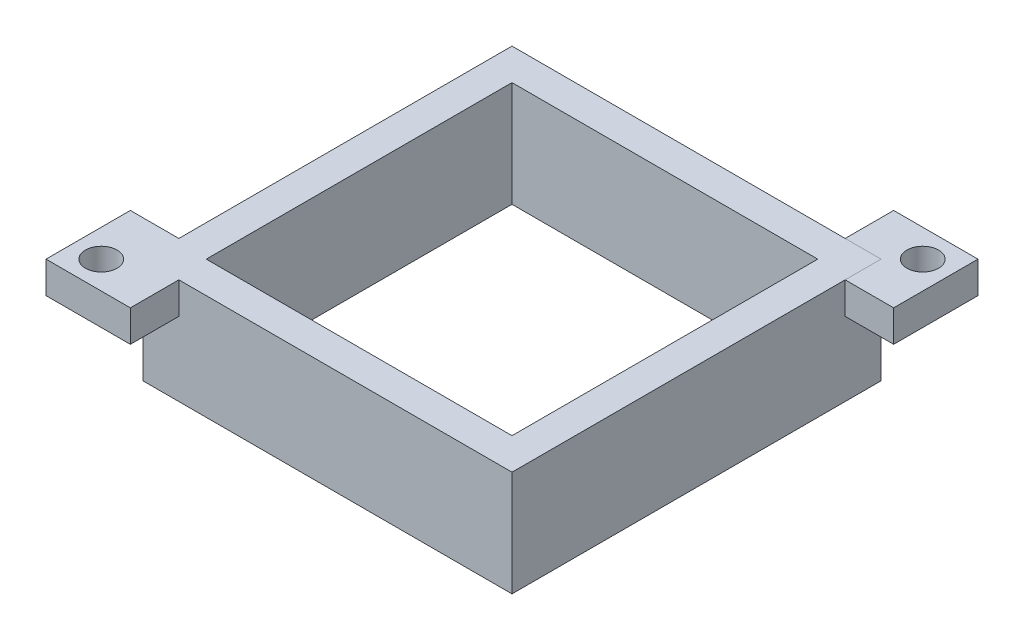
from build123d import *

# Parameters (mm, degrees)
SKETCH1_W           = 35
SKETCH1_H           = 35
SKETCH1_W_2         = 29
SKETCH1_H_2         = 29
BOSS_EXTRUDE1_DEPTH = 10
SKETCH2_R           = 1.5
BOSS_EXTRUDE2_DEPTH = 3


with BuildPart() as part:
    # Sketch1 → Boss-Extrude1 (new body)
    with BuildSketch(Plane(origin=(0, 0, 0), x_dir=(1, 0, 0), z_dir=(0, 1, 0))):
        Rectangle(SKETCH1_W, SKETCH1_H)
        Rectangle(SKETCH1_W_2, SKETCH1_H_2, mode=Mode.SUBTRACT)
    extrude(amount=BOSS_EXTRUDE1_DEPTH)


with BuildPart() as body_2:
    # Sketch2 → Boss-Extrude2 (new body)
    with BuildSketch(Plane(origin=(0, 10, 0), x_dir=(1, 0, 0), z_dir=(0, 1, 0))):
        Polygon((14.1, 17.5), (14.1, 22.1), (22.1, 22.1), (22.1, 14.1), (17.5, 14.1), (17.5, 17.5), align=None)
        with Locations((19.479898987, 19.479898987)):
            Circle(SKETCH2_R, mode=Mode.SUBTRACT)
    boss_extrude2 = extrude(amount=-BOSS_EXTRUDE2_DEPTH)


with BuildPart() as part_1:
    add(part.part)

    # Mirror3: Boss-Extrude2 across plane
    add(boss_extrude2.mirror(Plane(origin=(0, 0, 0), x_dir=(0.7071067811865476, 0, 0.7071067811865475), z_dir=(0.7071067811865475, 0, -0.7071067811865476))))


solid = Compound([body_2.part, part_1.part])
